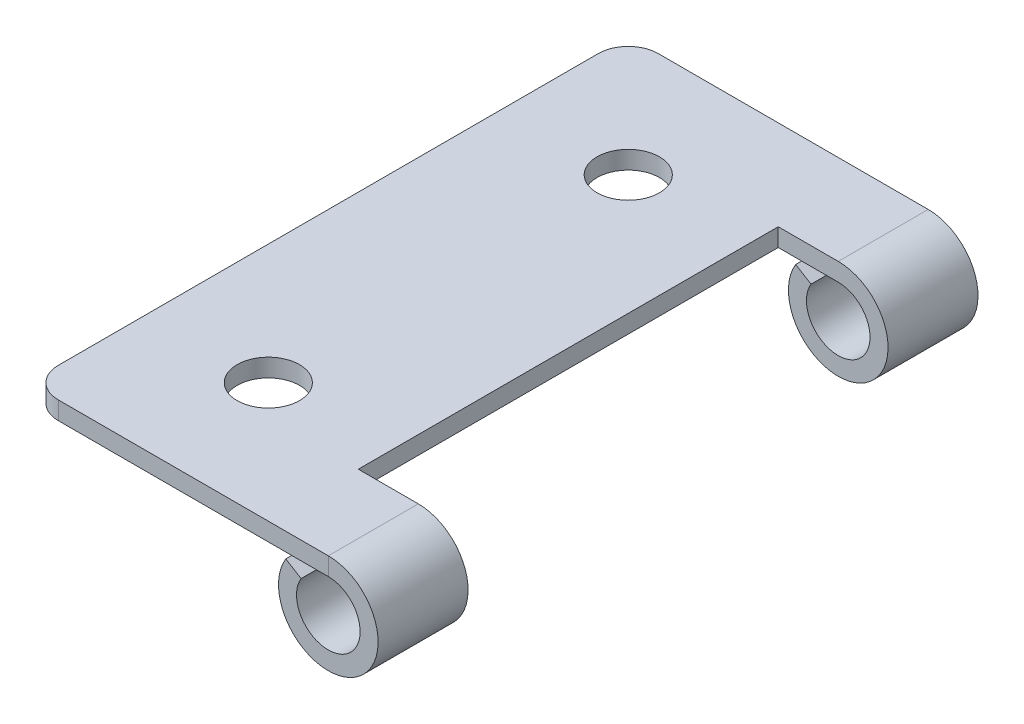
from build123d import *

# Parameters (mm, degrees)
TABAN_FLAN_1_DEPTH    = 25
IZIM9_W               = 9.15
IZIM9_H               = 35
KES_EKSTR_ZYON1_DEPTH = 32.162677998
IZIM11_R              = 2.6
KES_EKSTR_ZYON2_DEPTH = 10
RADYUS1_R             = 2.5


# Sheet-metal steps are written as plain solids
with BuildPart() as part:
    # Çizim1 → Taban-Flanş1 (new, symmetric)
    with BuildSketch(Plane.XY):
        with BuildLine():
            Line((-12.5, 0), (12.5, 0))
            ThreePointArc((12.5, 0), (14.537154879, -7.765591238), (8.95035213, -2))
            Line((8.95035213, -2), (10.233357384, -2.777108434))
            ThreePointArc((10.233357384, -2.777108434), (13.800833838, -6.458751031), (12.5, -1.5))
            Line((12.5, -1.5), (-12.5, -1.5))
            Line((-12.5, -1.5), (-12.5, 0))
        make_face()
    extrude(amount=TABAN_FLAN_1_DEPTH, both=True)

    # Çizim9 → Kes-Ekstrüzyon1 (cut, through all)
    with BuildSketch(Plane(origin=(0, 0, 0), x_dir=(1, 0, 0), z_dir=(0, 1, 0))):
        with Locations((12.075, 0)):
            Rectangle(IZIM9_W, IZIM9_H)
    extrude(amount=-KES_EKSTR_ZYON1_DEPTH, mode=Mode.SUBTRACT)

    # Çizim11 → Kes-Ekstrüzyon2 (cut)
    with BuildSketch(Plane(origin=(0, 0, 0), x_dir=(1, 0, 0), z_dir=(0, 1, 0))):
        with Locations(Location((-2.5, 15, 0), (0, 0, 180))):
            Circle(IZIM11_R)
        with Locations(Location((-2.5, -15, 0), (0, 0, 180))):
            Circle(IZIM11_R)
    extrude(amount=-KES_EKSTR_ZYON2_DEPTH, mode=Mode.SUBTRACT)

    # Radyus1
    radyus1_edges = [part.edges().sort_by_distance(p)[0] for p in [
        (-12.5, -0.75, 25),
        (-12.5, -0.75, -25),
    ]]
    fillet(radyus1_edges, radius=RADYUS1_R)


solid = part.part
